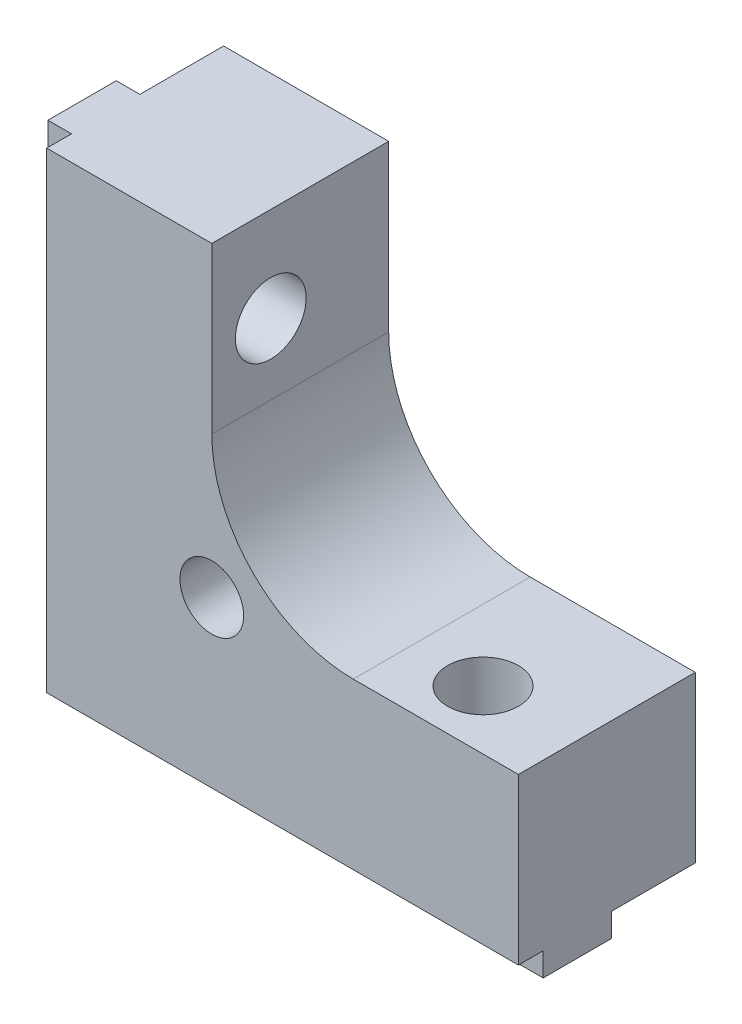
from build123d import *

# Parameters (mm, degrees)
MAIN_DEPTH                         = 10
ESQUISSE4_W                        = 2.9
ESQUISSE4_H                        = 20
MAKERBEAMFIXVERTICAL_DEPTH         = 1
MAKERBEAMVERTICALHOLE_DEPTH        = 31
MAKERBEAMVERTICALHOLE_DEPTH_BACK   = 31
ESQUISSE2_R                        = 1.5
ESQUISSE5_W                        = 20
ESQUISSE5_H                        = 2.9
MAKERBEAMFIXHORIZONTAL_DEPTH       = 1
MAKERBEAMHORIZONTALHOLE_DEPTH      = 31
MAKERBEAMHORIZONTALHOLE_DEPTH_BACK = 31
ESQUISSE3_R                        = 1.5
SKETCH1_R                          = 1.35
WINDOWFIXHOLE_DEPTH                = 31
SKETCH2_W                          = 2.5
SKETCH2_H                          = 20
WINDOW_DEPTH                       = 31


with BuildPart() as part:
    # Esquisse1 → Main (new body)
    with BuildSketch(Plane.XY):
        with BuildLine():
            Line((0, 0), (20, 0))
            Line((20, 0), (20, 7))
            Line((20, 7), (13, 7))
            ThreePointArc((13, 7), (8.757359313, 8.757359313), (7, 13))
            Line((7, 13), (7, 20))
            Line((7, 20), (0, 20))
            Line((0, 20), (0, 0))
        make_face()
    extrude(amount=MAIN_DEPTH)

    # Esquisse4 → MakerBeamFixVertical (add)
    with BuildSketch(Plane.ZY):
        with Locations((5, 10)):
            Rectangle(ESQUISSE4_W, ESQUISSE4_H)
    extrude(amount=MAKERBEAMFIXVERTICAL_DEPTH)

    # Esquisse2 → MakerBeamVerticalHole (cut, two sides: drawn at the far end of the back side and taken through both)
    with BuildSketch(Plane.ZY.offset(-MAKERBEAMVERTICALHOLE_DEPTH_BACK)):
        with Locations((5, 16)):
            Circle(ESQUISSE2_R)
    extrude(amount=MAKERBEAMVERTICALHOLE_DEPTH + MAKERBEAMVERTICALHOLE_DEPTH_BACK, mode=Mode.SUBTRACT)

    # Esquisse5 → MakerBeamFixHorizontal (add)
    with BuildSketch(Plane(origin=(0, 0, 0), x_dir=(-1, 0, 0), z_dir=(0, -1, 0))):
        with Locations((-10, -5)):
            Rectangle(ESQUISSE5_W, ESQUISSE5_H)
    extrude(amount=MAKERBEAMFIXHORIZONTAL_DEPTH)

    # Esquisse3 → MakerBeamHorizontalHole (cut, two sides: drawn at the far end of the back side and taken through both)
    with BuildSketch(Plane.XZ.offset(-MAKERBEAMHORIZONTALHOLE_DEPTH_BACK)):
        with Locations((16, 5)):
            Circle(ESQUISSE3_R)
    extrude(amount=MAKERBEAMHORIZONTALHOLE_DEPTH + MAKERBEAMHORIZONTALHOLE_DEPTH_BACK, mode=Mode.SUBTRACT)

    # Sketch1 → WindowFixHole (cut, through all)
    with BuildSketch(Plane.XY.offset(10)):
        with Locations((7, 7)):
            Circle(SKETCH1_R)
    extrude(amount=-WINDOWFIXHOLE_DEPTH, mode=Mode.SUBTRACT)

    # Sketch2 → Window (cut, through all)
    with BuildSketch(Plane.ZY):
        with Locations((8.75, 10)):
            Rectangle(SKETCH2_W, SKETCH2_H)
    extrude(amount=-WINDOW_DEPTH, mode=Mode.SUBTRACT)


solid = part.part
